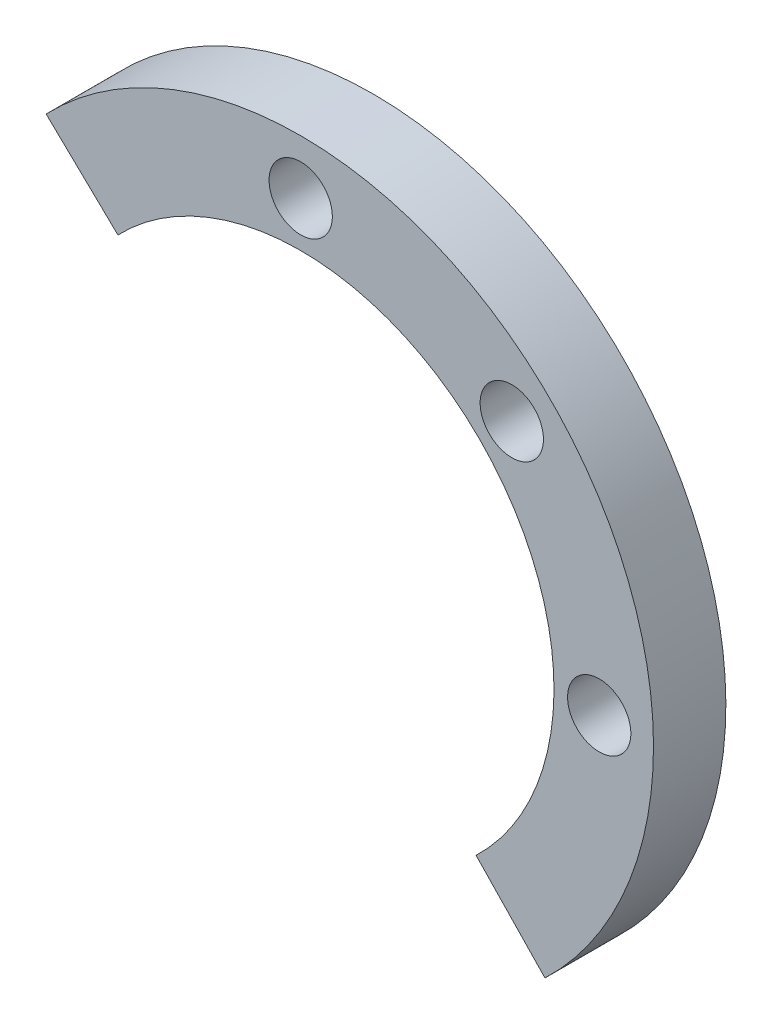
from build123d import *

# Parameters (mm, degrees)
SKETCH1_R           = 1.75
BOSS_EXTRUDE1_DEPTH = 4


with BuildPart() as part:
    # Sketch1 → Boss-Extrude1 (new body)
    with BuildSketch(Plane.XY):
        with BuildLine():
            Line((74.692307692, 54.897566056), (78.5, 50.928752721))
            ThreePointArc((78.5, 50.928752721), (78.788582233, 78.788582233), (50.928752721, 78.5))
            Line((50.928752721, 78.5), (54.897566056, 74.692307692))
            ThreePointArc((54.897566056, 74.692307692), (70.223309525, 77.989112272), (79, 65))
            ThreePointArc((79, 65), (77.878126954, 59.508748216), (74.692307692, 54.897566056))
        make_face()
        with Locations((81.5, 65)):
            Circle(SKETCH1_R, mode=Mode.SUBTRACT)
        with Locations((65, 81.5)):
            Circle(SKETCH1_R, mode=Mode.SUBTRACT)
        with Locations((76.66726189, 76.66726189)):
            Circle(SKETCH1_R, mode=Mode.SUBTRACT)
    extrude(amount=BOSS_EXTRUDE1_DEPTH)


solid = part.part
